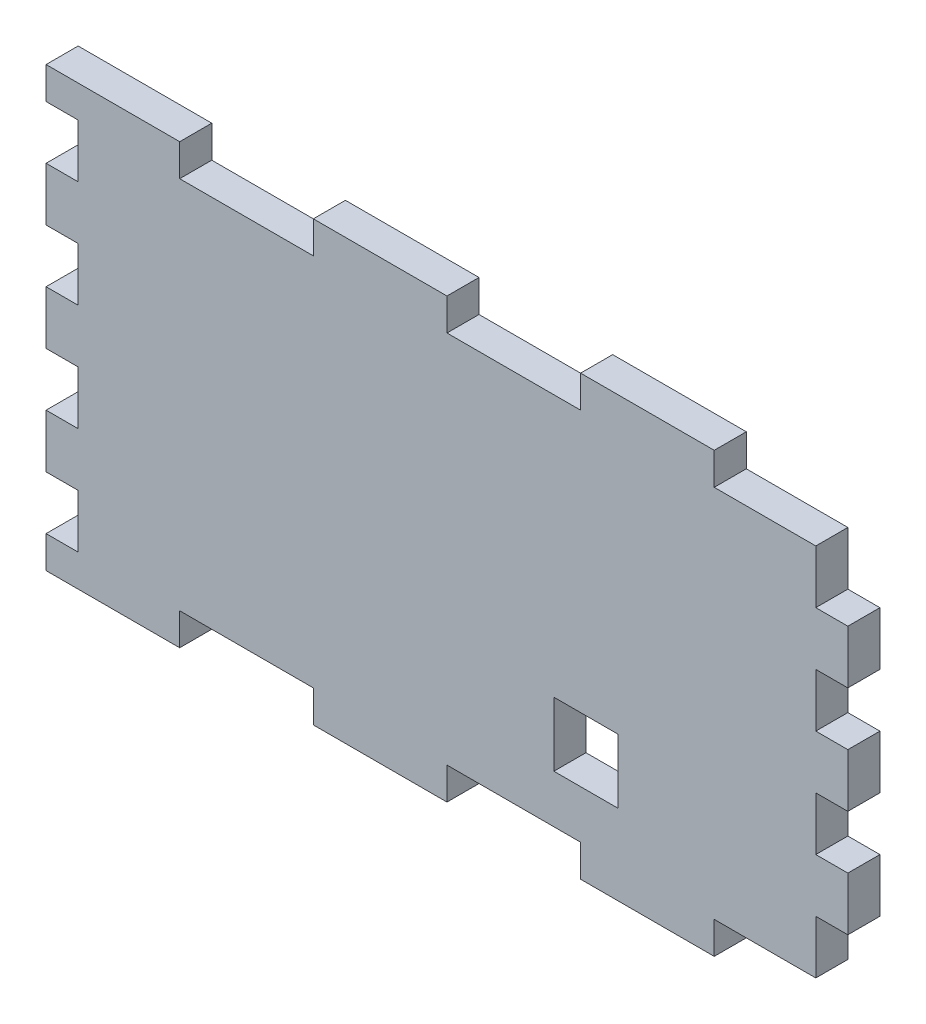
from build123d import *

# Parameters (mm, degrees)
SKETCH1_W           = 150
SKETCH1_H           = 82
BOSS_EXTRUDE1_DEPTH = 6
SKETCH3_W           = 6
SKETCH3_H           = 10
CUT_EXTRUDE1_DEPTH  = 10
SKETCH4_W           = 25
SKETCH4_H           = 6
CUT_EXTRUDE2_DEPTH  = 6
SKETCH5_W           = 12
SKETCH5_H           = 12
CUT_EXTRUDE3_DEPTH  = 10


with BuildPart() as part:
    # Sketch1 → Boss-Extrude1 (new body)
    with BuildSketch(Plane.XY):
        Rectangle(SKETCH1_W, SKETCH1_H)
    extrude(amount=BOSS_EXTRUDE1_DEPTH)

    # Sketch3 → Cut-Extrude1 (cut)
    with BuildSketch(Plane.XY.offset(6)):
        with Locations((-72, 30)):
            Rectangle(SKETCH3_W, SKETCH3_H)
        with Locations((72, 30)):
            Rectangle(SKETCH3_W, SKETCH3_H)
        with Locations((72, 10)):
            Rectangle(SKETCH3_W, SKETCH3_H)
        with Locations((-72, 10)):
            Rectangle(SKETCH3_W, SKETCH3_H)
        with Locations((-72, -10)):
            Rectangle(SKETCH3_W, SKETCH3_H)
        with Locations((72, -10)):
            Rectangle(SKETCH3_W, SKETCH3_H)
        with Locations((-72, -30)):
            Rectangle(SKETCH3_W, SKETCH3_H)
        with Locations((72, -30)):
            Rectangle(SKETCH3_W, SKETCH3_H)
    extrude(amount=-CUT_EXTRUDE1_DEPTH, mode=Mode.SUBTRACT)

    # Sketch4 → Cut-Extrude2 (cut)
    with BuildSketch(Plane.XY.offset(6)):
        with Locations((12.5, -38)):
            Rectangle(SKETCH4_W, SKETCH4_H)
        with Locations((62.5, -38)):
            Rectangle(SKETCH4_W, SKETCH4_H)
        with Locations((-37.5, -38)):
            Rectangle(SKETCH4_W, SKETCH4_H)
    cut_extrude2 = extrude(amount=-CUT_EXTRUDE2_DEPTH, mode=Mode.SUBTRACT)

    # Mirror1: Cut-Extrude2 across plane
    add(cut_extrude2.mirror(Plane.ZX), mode=Mode.SUBTRACT)

    # Sketch5 → Cut-Extrude3 (cut)
    with BuildSketch(Plane.XY.offset(6)):
        with Locations((26, -20)):
            Rectangle(SKETCH5_W, SKETCH5_H)
    extrude(amount=-CUT_EXTRUDE3_DEPTH, mode=Mode.SUBTRACT)


solid = part.part
